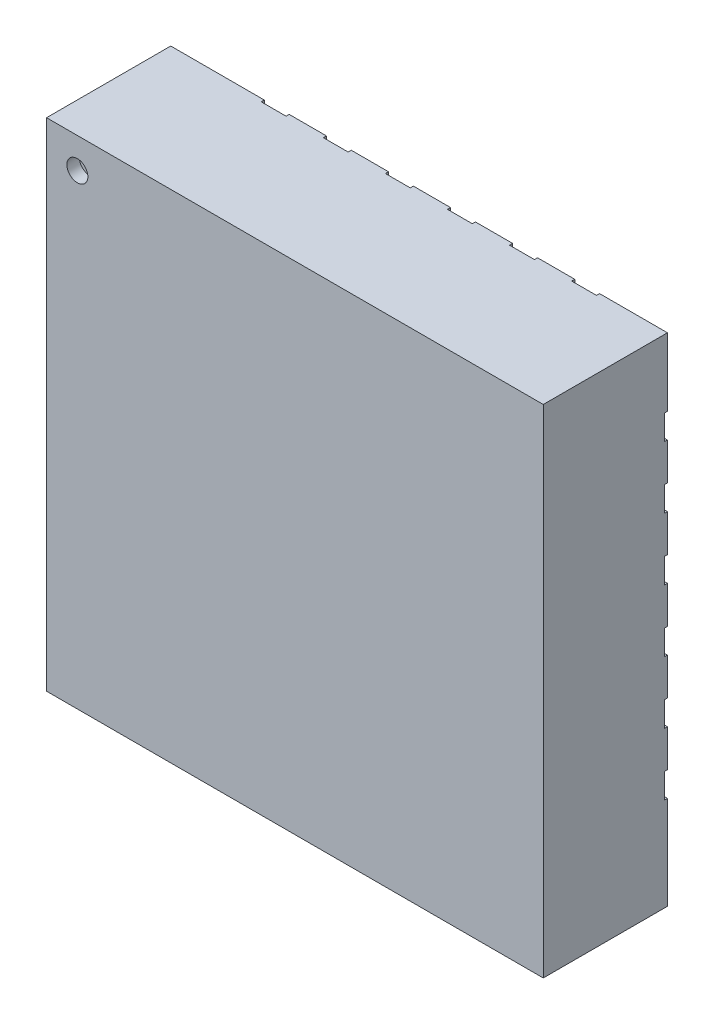
from build123d import *

# Parameters (mm, degrees)
SKETCH1_W                = 4
SKETCH1_H                = 4
BOSS_EXTRUDE1_DEPTH      = 1
SKETCH3_W                = 0.2
SKETCH3_H                = 0.35
BOSS_EXTRUDE2_DEPTH      = 0.01
SKETCH5_W                = 0.199992209
SKETCH5_H                = 0.1
CUT_EXTRUDE2_DEPTH       = 0.025
LPATTERN5_COUNT          = 6
LPATTERN5_PITCH          = 0.5
LPATTERN6_COUNT          = 6
LPATTERN6_PITCH          = 0.5
MIRROR6_START            = 0.753594945
MIRROR6_OUTLINE_W        = 0.1
MIRROR6_OUTLINE_H        = 0.025
MIRROR6_DEPTH            = 0.2
MIRROR6_START_2          = 1.253594945
MIRROR6_2_OUTLINE_W      = 0.1
MIRROR6_2_OUTLINE_H      = 0.025
MIRROR6_2_DEPTH          = 0.2
MIRROR6_START_3          = 1.753594945
MIRROR6_3_OUTLINE_W      = 0.1
MIRROR6_3_OUTLINE_H      = 0.025
MIRROR6_3_DEPTH          = 0.2
MIRROR6_START_4          = 2.253594945
MIRROR6_4_OUTLINE_W      = 0.1
MIRROR6_4_OUTLINE_H      = 0.025
MIRROR6_4_DEPTH          = 0.2
MIRROR6_START_5          = 2.753594945
MIRROR6_5_OUTLINE_W      = 0.1
MIRROR6_5_OUTLINE_H      = 0.025
MIRROR6_5_DEPTH          = 0.2
MIRROR6_START_6          = 3.253594945
MIRROR6_6_OUTLINE_W      = 0.1
MIRROR6_6_OUTLINE_H      = 0.025
MIRROR6_6_DEPTH          = 0.2
MIRROR6_7_OUTLINE_W      = 0.35
MIRROR6_7_OUTLINE_H      = 0.01
MIRROR6_7_DEPTH          = 0.2
MIRROR6_8_OUTLINE_W      = 0.35
MIRROR6_8_OUTLINE_H      = 0.01
MIRROR6_8_DEPTH          = 0.2
MIRROR6_9_OUTLINE_W      = 0.35
MIRROR6_9_OUTLINE_H      = 0.01
MIRROR6_9_DEPTH          = 0.2
MIRROR6_10_OUTLINE_W     = 0.35
MIRROR6_10_OUTLINE_H     = 0.01
MIRROR6_10_DEPTH         = 0.2
MIRROR6_11_OUTLINE_W     = 0.35
MIRROR6_11_OUTLINE_H     = 0.01
MIRROR6_11_DEPTH         = 0.2
MIRROR6_12_OUTLINE_W     = 0.35
MIRROR6_12_OUTLINE_H     = 0.01
MIRROR6_12_DEPTH         = 0.2
SKETCH8_W                = 0.35004079
SKETCH8_H                = 0.199834334
BOSS_EXTRUDE3_DEPTH      = 0.01
LPATTERN7_COUNT          = 6
LPATTERN7_PITCH          = 0.5
SKETCH10_W               = 0.095393653
SKETCH10_H               = 0.199834334
CUT_EXTRUDE3_DEPTH       = 0.025
LPATTERN8_COUNT          = 6
LPATTERN8_PITCH          = 0.5
MIRROR7_COPY_1_SKETCH_W  = 0.35004079
MIRROR7_COPY_1_SKETCH_H  = 0.199834334
MIRROR7_COPY_1_DEPTH     = 0.01
MIRROR7_COPY_2_SKETCH_W  = 0.35004079
MIRROR7_COPY_2_SKETCH_H  = 0.199834334
MIRROR7_COPY_2_DEPTH     = 0.01
MIRROR7_COPY_3_SKETCH_W  = 0.35004079
MIRROR7_COPY_3_SKETCH_H  = 0.199834334
MIRROR7_COPY_3_DEPTH     = 0.01
MIRROR7_COPY_4_SKETCH_W  = 0.35004079
MIRROR7_COPY_4_SKETCH_H  = 0.199834334
MIRROR7_COPY_4_DEPTH     = 0.01
MIRROR7_COPY_5_SKETCH_W  = 0.35004079
MIRROR7_COPY_5_SKETCH_H  = 0.199834334
MIRROR7_COPY_5_DEPTH     = 0.01
MIRROR7_COPY_6_SKETCH_W  = 0.095393653
MIRROR7_COPY_6_SKETCH_H  = 0.199834334
MIRROR7_COPY_6_DEPTH     = 0.025
MIRROR7_COPY_7_SKETCH_W  = 0.095393653
MIRROR7_COPY_7_SKETCH_H  = 0.199834334
MIRROR7_COPY_7_DEPTH     = 0.025
MIRROR7_COPY_8_SKETCH_W  = 0.095393653
MIRROR7_COPY_8_SKETCH_H  = 0.199834334
MIRROR7_COPY_8_DEPTH     = 0.025
MIRROR7_COPY_9_SKETCH_W  = 0.095393653
MIRROR7_COPY_9_SKETCH_H  = 0.199834334
MIRROR7_COPY_9_DEPTH     = 0.025
MIRROR7_COPY_10_SKETCH_W = 0.095393653
MIRROR7_COPY_10_SKETCH_H = 0.199834334
MIRROR7_COPY_10_DEPTH    = 0.025
CUT_EXTRUDE4_START       = 1
SKETCH11_R               = 0.084430111
CUT_EXTRUDE4_DEPTH       = 0.1


# Read off the part's stored shape, not the designer's step: Mirror6
with BuildPart() as part:
    # Sketch1 → Boss-Extrude1 (new body)
    with BuildSketch(Plane.XY):
        with Locations((2, 2)):
            Rectangle(SKETCH1_W, SKETCH1_H)
    extrude(amount=BOSS_EXTRUDE1_DEPTH)

    # Sketch3 → Boss-Extrude2 (add)
    with BuildSketch(Plane.XY):
        with Locations((3.353594945, 3.725)):
            Rectangle(SKETCH3_W, SKETCH3_H)
    boss_extrude2 = extrude(amount=-BOSS_EXTRUDE2_DEPTH)

    # Sketch5 → Cut-Extrude2 (cut)
    with BuildSketch(Plane.XY):
        with Locations((3.353598841, 3.95)):
            Rectangle(SKETCH5_W, SKETCH5_H)
    cut_extrude2 = extrude(amount=CUT_EXTRUDE2_DEPTH, mode=Mode.SUBTRACT)

    # LPattern5: Cut-Extrude2 ×6
    with Locations(*[(-i * LPATTERN5_PITCH, 0, 0) for i in range(1, LPATTERN5_COUNT)]):
        add(cut_extrude2, mode=Mode.SUBTRACT)

    # LPattern6: Boss-Extrude2 ×6
    with Locations(*[(-i * LPATTERN6_PITCH, 0, 0) for i in range(1, LPATTERN6_COUNT)]):
        add(boss_extrude2)

    # Mirror6 outline → Mirror6 (cut)
    with BuildSketch(Plane.YZ.offset(MIRROR6_START)):
        with Locations((0.05, 0.0125)):
            Rectangle(MIRROR6_OUTLINE_W, MIRROR6_OUTLINE_H)
    extrude(amount=MIRROR6_DEPTH, mode=Mode.SUBTRACT)

    # Mirror6 2 outline → Mirror6 2 (cut)
    with BuildSketch(Plane.YZ.offset(MIRROR6_START_2)):
        with Locations((0.05, 0.0125)):
            Rectangle(MIRROR6_2_OUTLINE_W, MIRROR6_2_OUTLINE_H)
    extrude(amount=MIRROR6_2_DEPTH, mode=Mode.SUBTRACT)

    # Mirror6 3 outline → Mirror6 3 (cut)
    with BuildSketch(Plane.YZ.offset(MIRROR6_START_3)):
        with Locations((0.05, 0.0125)):
            Rectangle(MIRROR6_3_OUTLINE_W, MIRROR6_3_OUTLINE_H)
    extrude(amount=MIRROR6_3_DEPTH, mode=Mode.SUBTRACT)

    # Mirror6 4 outline → Mirror6 4 (cut)
    with BuildSketch(Plane.YZ.offset(MIRROR6_START_4)):
        with Locations((0.05, 0.0125)):
            Rectangle(MIRROR6_4_OUTLINE_W, MIRROR6_4_OUTLINE_H)
    extrude(amount=MIRROR6_4_DEPTH, mode=Mode.SUBTRACT)

    # Mirror6 5 outline → Mirror6 5 (cut)
    with BuildSketch(Plane.YZ.offset(MIRROR6_START_5)):
        with Locations((0.05, 0.0125)):
            Rectangle(MIRROR6_5_OUTLINE_W, MIRROR6_5_OUTLINE_H)
    extrude(amount=MIRROR6_5_DEPTH, mode=Mode.SUBTRACT)

    # Mirror6 6 outline → Mirror6 6 (cut)
    with BuildSketch(Plane.YZ.offset(MIRROR6_START_6)):
        with Locations((0.05, 0.0125)):
            Rectangle(MIRROR6_6_OUTLINE_W, MIRROR6_6_OUTLINE_H)
    extrude(amount=MIRROR6_6_DEPTH, mode=Mode.SUBTRACT)

    # Mirror6 7 outline → Mirror6 7 (add)
    with BuildSketch(Plane.YZ.offset(MIRROR6_START)):
        with Locations((0.275, -0.005)):
            Rectangle(MIRROR6_7_OUTLINE_W, MIRROR6_7_OUTLINE_H)
    extrude(amount=MIRROR6_7_DEPTH)

    # Mirror6 8 outline → Mirror6 8 (add)
    with BuildSketch(Plane.YZ.offset(MIRROR6_START_2)):
        with Locations((0.275, -0.005)):
            Rectangle(MIRROR6_8_OUTLINE_W, MIRROR6_8_OUTLINE_H)
    extrude(amount=MIRROR6_8_DEPTH)

    # Mirror6 9 outline → Mirror6 9 (add)
    with BuildSketch(Plane.YZ.offset(MIRROR6_START_3)):
        with Locations((0.275, -0.005)):
            Rectangle(MIRROR6_9_OUTLINE_W, MIRROR6_9_OUTLINE_H)
    extrude(amount=MIRROR6_9_DEPTH)

    # Mirror6 10 outline → Mirror6 10 (add)
    with BuildSketch(Plane.YZ.offset(MIRROR6_START_4)):
        with Locations((0.275, -0.005)):
            Rectangle(MIRROR6_10_OUTLINE_W, MIRROR6_10_OUTLINE_H)
    extrude(amount=MIRROR6_10_DEPTH)

    # Mirror6 11 outline → Mirror6 11 (add)
    with BuildSketch(Plane.YZ.offset(MIRROR6_START_5)):
        with Locations((0.275, -0.005)):
            Rectangle(MIRROR6_11_OUTLINE_W, MIRROR6_11_OUTLINE_H)
    extrude(amount=MIRROR6_11_DEPTH)

    # Mirror6 12 outline → Mirror6 12 (add)
    with BuildSketch(Plane.YZ.offset(MIRROR6_START_6)):
        with Locations((0.275, -0.005)):
            Rectangle(MIRROR6_12_OUTLINE_W, MIRROR6_12_OUTLINE_H)
    extrude(amount=MIRROR6_12_DEPTH)

    # Sketch8 → Boss-Extrude3 (add)
    with BuildSketch(Plane.XY):
        with Locations((3.729585952, 3.352470352)):
            Rectangle(SKETCH8_W, SKETCH8_H)
    boss_extrude3 = extrude(amount=-BOSS_EXTRUDE3_DEPTH)

    # LPattern7: Boss-Extrude3 ×6
    with Locations(*[(0, -i * LPATTERN7_PITCH, 0) for i in range(1, LPATTERN7_COUNT)]):
        add(boss_extrude3)

    # Sketch10 → Cut-Extrude3 (cut)
    with BuildSketch(Plane.XY):
        with Locations((3.952303173, 3.352470352)):
            Rectangle(SKETCH10_W, SKETCH10_H)
    cut_extrude3 = extrude(amount=CUT_EXTRUDE3_DEPTH, mode=Mode.SUBTRACT)

    # LPattern8: Cut-Extrude3 ×6
    with Locations(*[(0, -i * LPATTERN8_PITCH, 0) for i in range(1, LPATTERN8_COUNT)]):
        add(cut_extrude3, mode=Mode.SUBTRACT)

    # Mirror7: Boss-Extrude3, Cut-Extrude3 across plane
    add(boss_extrude3.mirror(Plane(origin=(2, 0, 0), x_dir=(0, 0, 1), z_dir=(1, 0, 0))))
    add(cut_extrude3.mirror(Plane(origin=(2, 0, 0), x_dir=(0, 0, 1), z_dir=(1, 0, 0))), mode=Mode.SUBTRACT)

    # Mirror7 copy 1 sketch → Mirror7 copy 1 (add)
    with BuildSketch(Plane(origin=(4, -0.5, 0), x_dir=(-1, 0, 0), z_dir=(0, 0, 1))):
        with Locations((3.729585952, -3.352470352)):
            Rectangle(MIRROR7_COPY_1_SKETCH_W, MIRROR7_COPY_1_SKETCH_H)
    extrude(amount=-MIRROR7_COPY_1_DEPTH)

    # Mirror7 copy 2 sketch → Mirror7 copy 2 (add)
    with BuildSketch(Plane(origin=(4, -1, 0), x_dir=(-1, 0, 0), z_dir=(0, 0, 1))):
        with Locations((3.729585952, -3.352470352)):
            Rectangle(MIRROR7_COPY_2_SKETCH_W, MIRROR7_COPY_2_SKETCH_H)
    extrude(amount=-MIRROR7_COPY_2_DEPTH)

    # Mirror7 copy 3 sketch → Mirror7 copy 3 (add)
    with BuildSketch(Plane(origin=(4, -1.5, 0), x_dir=(-1, 0, 0), z_dir=(0, 0, 1))):
        with Locations((3.729585952, -3.352470352)):
            Rectangle(MIRROR7_COPY_3_SKETCH_W, MIRROR7_COPY_3_SKETCH_H)
    extrude(amount=-MIRROR7_COPY_3_DEPTH)

    # Mirror7 copy 4 sketch → Mirror7 copy 4 (add)
    with BuildSketch(Plane(origin=(4, -2, 0), x_dir=(-1, 0, 0), z_dir=(0, 0, 1))):
        with Locations((3.729585952, -3.352470352)):
            Rectangle(MIRROR7_COPY_4_SKETCH_W, MIRROR7_COPY_4_SKETCH_H)
    extrude(amount=-MIRROR7_COPY_4_DEPTH)

    # Mirror7 copy 5 sketch → Mirror7 copy 5 (add)
    with BuildSketch(Plane(origin=(4, -2.5, 0), x_dir=(-1, 0, 0), z_dir=(0, 0, 1))):
        with Locations((3.729585952, -3.352470352)):
            Rectangle(MIRROR7_COPY_5_SKETCH_W, MIRROR7_COPY_5_SKETCH_H)
    extrude(amount=-MIRROR7_COPY_5_DEPTH)

    # Mirror7 copy 6 sketch → Mirror7 copy 6 (cut)
    with BuildSketch(Plane(origin=(4, -0.5, 0), x_dir=(-1, 0, 0), z_dir=(0, 0, 1))):
        with Locations((3.952303173, -3.352470352)):
            Rectangle(MIRROR7_COPY_6_SKETCH_W, MIRROR7_COPY_6_SKETCH_H)
    extrude(amount=MIRROR7_COPY_6_DEPTH, mode=Mode.SUBTRACT)

    # Mirror7 copy 7 sketch → Mirror7 copy 7 (cut)
    with BuildSketch(Plane(origin=(4, -1, 0), x_dir=(-1, 0, 0), z_dir=(0, 0, 1))):
        with Locations((3.952303173, -3.352470352)):
            Rectangle(MIRROR7_COPY_7_SKETCH_W, MIRROR7_COPY_7_SKETCH_H)
    extrude(amount=MIRROR7_COPY_7_DEPTH, mode=Mode.SUBTRACT)

    # Mirror7 copy 8 sketch → Mirror7 copy 8 (cut)
    with BuildSketch(Plane(origin=(4, -1.5, 0), x_dir=(-1, 0, 0), z_dir=(0, 0, 1))):
        with Locations((3.952303173, -3.352470352)):
            Rectangle(MIRROR7_COPY_8_SKETCH_W, MIRROR7_COPY_8_SKETCH_H)
    extrude(amount=MIRROR7_COPY_8_DEPTH, mode=Mode.SUBTRACT)

    # Mirror7 copy 9 sketch → Mirror7 copy 9 (cut)
    with BuildSketch(Plane(origin=(4, -2, 0), x_dir=(-1, 0, 0), z_dir=(0, 0, 1))):
        with Locations((3.952303173, -3.352470352)):
            Rectangle(MIRROR7_COPY_9_SKETCH_W, MIRROR7_COPY_9_SKETCH_H)
    extrude(amount=MIRROR7_COPY_9_DEPTH, mode=Mode.SUBTRACT)

    # Mirror7 copy 10 sketch → Mirror7 copy 10 (cut)
    with BuildSketch(Plane(origin=(4, -2.5, 0), x_dir=(-1, 0, 0), z_dir=(0, 0, 1))):
        with Locations((3.952303173, -3.352470352)):
            Rectangle(MIRROR7_COPY_10_SKETCH_W, MIRROR7_COPY_10_SKETCH_H)
    extrude(amount=MIRROR7_COPY_10_DEPTH, mode=Mode.SUBTRACT)

    # Sketch11 → Cut-Extrude4 (cut)
    with BuildSketch(Plane.XY.offset(CUT_EXTRUDE4_START)):
        with Locations((0.248028203, 3.754411869)):
            Circle(SKETCH11_R)
    extrude(amount=-CUT_EXTRUDE4_DEPTH, mode=Mode.SUBTRACT)


solid = part.part
